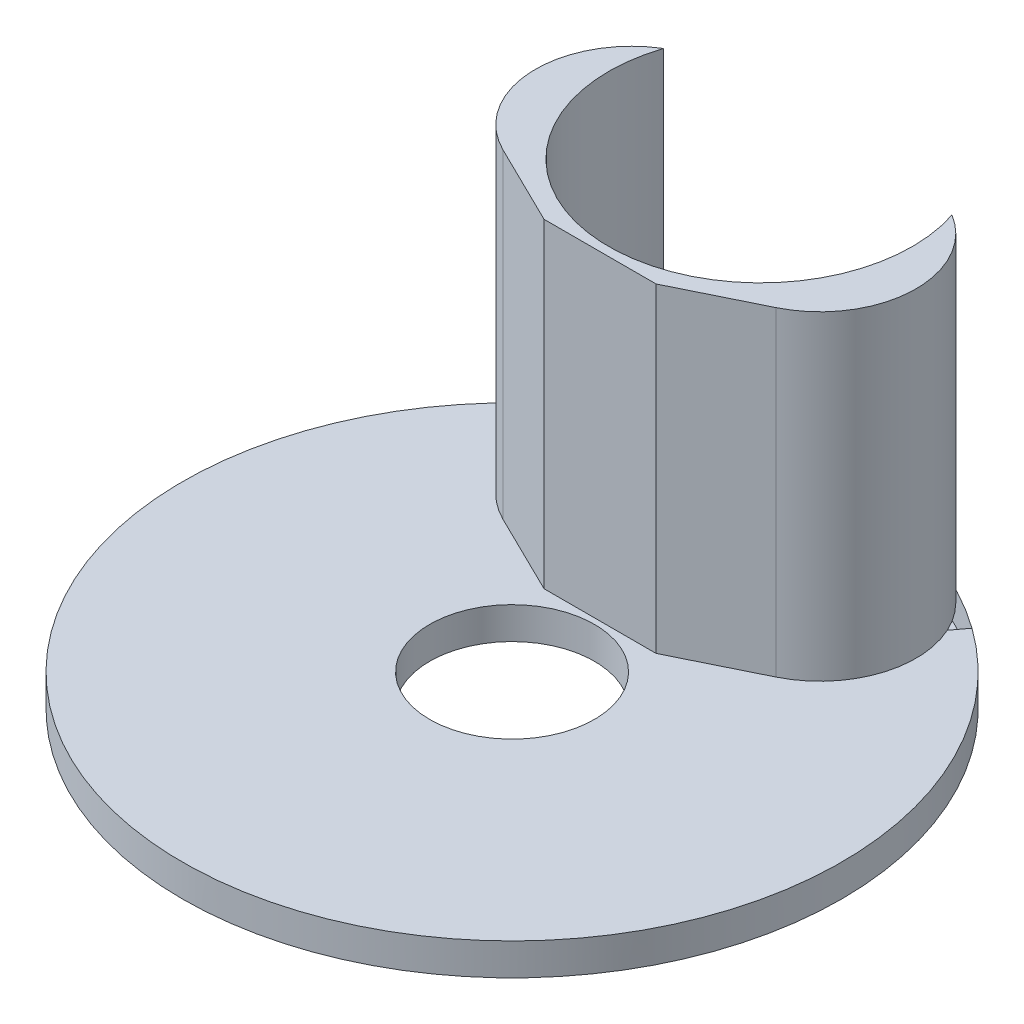
from build123d import *

# Parameters (mm, degrees)
SKETCH1_R           = 20.6
BOSS_EXTRUDE1_DEPTH = 2
SKETCH2_R           = 5.15
CUT_EXTRUDE1_DEPTH  = 3
SKETCH3_R           = 6.5
CUT_EXTRUDE2_DEPTH  = 2
BOSS_EXTRUDE4_DEPTH = 20
FILLET2_R           = 6


with BuildPart() as part:
    # Sketch1 → Boss-Extrude1 (new body)
    with BuildSketch(Plane(origin=(0, 0, 0), x_dir=(1, 0, 0), z_dir=(0, 1, 0))):
        with Locations(Location((0, 0, 0), (0, 0, 270))):
            Circle(SKETCH1_R)
    extrude(amount=BOSS_EXTRUDE1_DEPTH)

    # Sketch2 → Cut-Extrude1 (cut)
    with BuildSketch(Plane(origin=(0, 2, 0), x_dir=(1, 0, 0), z_dir=(0, 1, 0))):
        with Locations(Location((0, 0, 0), (0, 0, 270))):
            Circle(SKETCH2_R)
    extrude(amount=-CUT_EXTRUDE1_DEPTH, mode=Mode.SUBTRACT)

    # Sketch3 → Cut-Extrude2 (cut)
    with BuildSketch(Plane(origin=(0, 2, 0), x_dir=(1, 0, 0), z_dir=(0, 1, 0))):
        with Locations(Location((0, 13, 0), (0, 0, 270))):
            Circle(SKETCH3_R)
    extrude(amount=-CUT_EXTRUDE2_DEPTH, mode=Mode.SUBTRACT)

    # Sketch4 → Boss-Extrude4 (add)
    with BuildSketch(Plane(origin=(0, 2, 0), x_dir=(1, 0, 0), z_dir=(0, 1, 0))):
        with BuildLine():
            Line((-16.743954133, 12), (-3.5, 5.5))
            Line((-3.5, 5.5), (3.5, 5.5))
            Line((3.5, 5.5), (16.743954133, 12))
            ThreePointArc((16.743954133, 12), (13.279606143, 15.748398671), (9, 18.529975715))
            ThreePointArc((9, 18.529975715), (0, 6.042759079), (-9, 18.529975715))
            ThreePointArc((-9, 18.529975715), (-13.279606143, 15.748398671), (-16.743954133, 12))
        make_face()
    extrude(amount=BOSS_EXTRUDE4_DEPTH)

    # Fillet2
    # the kernel refuses this fillet: 6 mm, written as the material it takes off along each edge
    with BuildSketch(Plane(origin=(16.743954133, 2, -12), x_dir=(-0.7761796310564387, 0, -0.6305118399626535), z_dir=(0, 1, 0))) as fillet2_piece_1:
        with BuildLine():
            CenterArc((9.278744028, 5.78779133), FILLET2_R, 155.229237023, 130.054584679)
            Line((3.830795632, 8.301724161), (0, 0))
            ThreePointArc((0, 0), (5.430174062, -0.728583099), (10.860348123, 0))
        make_face()
    extrude(amount=47.150870308, mode=Mode.SUBTRACT)
    with BuildSketch(Plane(origin=(-16.743954133, 2, -12), x_dir=(0.7761796310564387, 0, -0.6305118399626534), z_dir=(0, 1, 0))) as fillet2_piece_2:
        with BuildLine():
            CenterArc((9.278744028, -5.78779133), FILLET2_R, 74.716178298, 130.054584679)
            Line((3.830795632, -8.301724161), (0, 0))
            ThreePointArc((0, 0), (5.430174062, 0.728583099), (10.860348123, 0))
        make_face()
    extrude(amount=47.150870308, mode=Mode.SUBTRACT)


solid = part.part
